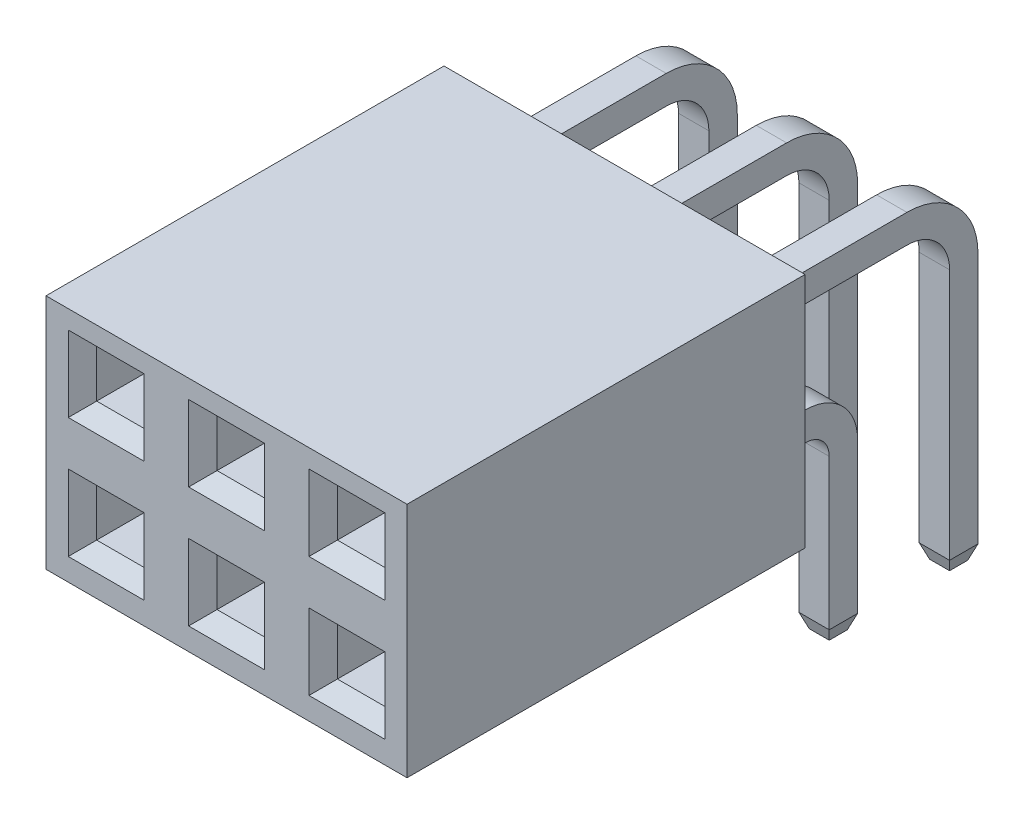
from build123d import *
from OCP.BRepFilletAPI import BRepFilletAPI_MakeChamfer
from build123d.topology import SkipClean

# Parameters (mm, degrees)
EXTRUDE_2563_DEPTH                    = 0.32
EXTRUDE_2563_2_DEPTH                  = 0.32
SKETCH_2_W                            = 2.54
SKETCH_2_H                            = 8.4
EXTRUDE_2921_DEPTH                    = 5
SKETCH_3_W                            = 1
SKETCH_3_H                            = 1
CUT_EXTRUDE_3170_DEPTH                = 6
CHAMFER_1_SIZE                        = 0.3
CHAMFER_2_SIZE                        = 0.3
CHAMFER_2_SIZE2                       = 0.10919107
PATTERN_LINEAR_3747_COUNT             = 3
PATTERN_LINEAR_3747_PITCH             = 2.54
CHAMFER_1_OF_PATTERN_LINEAR_3747_SIZE = 0.3
PATTERN_START                         = -5.29080893
PATTERN_LINEAR_12180_DEPTH            = 0.42161786
PATTERN_START_2                       = -2.75080893
PATTERN_LINEAR_12180_2_DEPTH          = 0.42161786
PATTERN_START_3                       = -0.19080893
PATTERN_LINEAR_12180_3_OUTLINE_W      = 0.10919107
PATTERN_LINEAR_12180_3_OUTLINE_H      = 0.6
PATTERN_LINEAR_12180_3_DEPTH          = 0.99080893
PATTERN_START_4                       = -2.84
PATTERN_LINEAR_12180_4_DEPTH          = 0.6
PATTERN_START_5                       = -2.73080893
PATTERN_LINEAR_12180_5_OUTLINE_W      = 0.10919107
PATTERN_LINEAR_12180_5_OUTLINE_H      = 2.54
PATTERN_LINEAR_12180_5_DEPTH          = 1.39080893
PATTERN_START_6                       = -1.484615596
PATTERN_LINEAR_12180_6_OUTLINE_W      = 0.10919107
PATTERN_LINEAR_12180_6_OUTLINE_H      = 0.6
PATTERN_LINEAR_12180_6_DEPTH          = 4.484615596
PATTERN_START_7                       = 0.719658002
PATTERN_LINEAR_12180_7_OUTLINE_W      = 0.10919107
PATTERN_LINEAR_12180_7_OUTLINE_H      = 0.6
PATTERN_LINEAR_12180_7_DEPTH          = 2.280341998
PATTERN_START_8                       = -0.3
PATTERN_LINEAR_12180_8_DEPTH          = 0.49080893
PATTERN_START_9                       = -5.4
PATTERN_LINEAR_12180_9_DEPTH          = 3.18


with BuildPart() as part:
    # Эскиз1 → Extrude 2563 (new, symmetric)
    with BuildSketch(Plane(origin=(0, 0, 0), x_dir=(0, 0, -1), z_dir=(1, 0, 0))):
        with BuildLine():
            Line((0.3, -3), (0.3, 0.47))
            ThreePointArc((0.3, 0.47), (-0.022182541, 1.247817459), (-0.8, 1.57))
            Line((-0.8, 1.57), (-4.16, 1.57))
            Line((-4.16, 1.57), (-4.16, 0.97))
            Line((-4.16, 0.97), (-0.8, 0.97))
            ThreePointArc((-0.8, 0.97), (-0.446446609, 0.823553391), (-0.3, 0.47))
            Line((-0.3, 0.47), (-0.3, -3))
            Line((-0.3, -3), (0.3, -3))
        make_face()
    extrude(amount=EXTRUDE_2563_DEPTH, both=True)



with BuildPart() as body_2:
    # Эскиз1 → Extrude 2563 2 (new, symmetric)
    with BuildSketch(Plane(origin=(0, 0, 0), x_dir=(0, 0, -1), z_dir=(1, 0, 0))):
        with BuildLine():
            Line((2.84, -3), (2.84, 2.61))
            ThreePointArc((2.84, 2.61), (2.400660172, 3.670660172), (1.34, 4.11))
            Line((1.34, 4.11), (-4.16, 4.11))
            Line((-4.16, 4.11), (-4.16, 3.51))
            Line((-4.16, 3.51), (1.34, 3.51))
            ThreePointArc((1.34, 3.51), (1.976396103, 3.246396103), (2.24, 2.61))
            Line((2.24, 2.61), (2.24, -3))
            Line((2.24, -3), (2.84, -3))
        make_face()
    extrude(amount=EXTRUDE_2563_2_DEPTH, both=True)


with BuildPart() as part_1:
    add(part.part)

    add(body_2.part)  # Extrude 2921 merges body 2
    # Эскиз2 → Extrude 2921 (add)
    with BuildSketch(Plane(origin=(0, 0, 0), x_dir=(1, 0, 0), z_dir=(0, 1, 0))):
        with Locations((0, -5.96)):
            Rectangle(SKETCH_2_W, SKETCH_2_H)
    extrude_2921 = extrude(amount=EXTRUDE_2921_DEPTH)

    # Эскиз3 → Cut-Extrude 3170 (cut)
    with BuildSketch(Plane.XY.offset(10.16)):
        with Locations((0, 1.27)):
            Rectangle(SKETCH_3_W, SKETCH_3_H)
        with Locations((0, 3.81)):
            Rectangle(SKETCH_3_W, SKETCH_3_H)
    cut_extrude_3170 = extrude(amount=-CUT_EXTRUDE_3170_DEPTH, mode=Mode.SUBTRACT)

    # Фаска1
    chamfer_1_edges = [part_1.edges().sort_by_distance(p)[0] for p in [
        (-0.5, 1.27, 10.16),
        (0, 0.77, 10.16),
        (0.5, 1.27, 10.16),
        (0, 1.77, 10.16),
        (-0.5, 3.81, 10.16),
        (0, 3.31, 10.16),
        (0.5, 3.81, 10.16),
        (0, 4.31, 10.16),
    ]]
    chamfer(chamfer_1_edges, length=CHAMFER_1_SIZE)

    # Фаска2: one chamfer whose edges measure the first distance from different faces: ONE call of the kernel's chamfer builder (chamfer() names one face for all edges)
    chamfer_2_edges_1 = [part_1.edges().sort_by_distance(p)[0] for p in [
        (-0.32, -3, 0),
    ]]
    chamfer_2_side_1 = [part_1.faces().sort_by_distance(p)[0] for p in [
        (-0.32, -0.335827759, 0.275050022),
    ]]
    chamfer_2_edges_2 = [part_1.edges().sort_by_distance(p)[0] for p in [
        (0, -3, 0.3),
    ]]
    chamfer_2_side_2 = [part_1.faces().sort_by_distance(p)[0] for p in [
        (0, -1.265, 0.3),
    ]]
    chamfer_2_edges_3 = [part_1.edges().sort_by_distance(p)[0] for p in [
        (0, -3, -0.3),
    ]]
    chamfer_2_side_3 = [part_1.faces().sort_by_distance(p)[0] for p in [
        (0, -1.265, -0.3),
    ]]
    chamfer_2_edges_4 = [part_1.edges().sort_by_distance(p)[0] for p in [
        (0.32, -3, 0),
    ]]
    chamfer_2_side_4 = [part_1.faces().sort_by_distance(p)[0] for p in [
        (0.32, -0.335827759, 0.275050022),
    ]]
    chamfer_2_edges_5 = [part_1.edges().sort_by_distance(p)[0] for p in [
        (0.32, -3, -2.54),
    ]]
    chamfer_2_side_5 = [part_1.faces().sort_by_distance(p)[0] for p in [
        (0.32, -2.915317003, -2.54),
    ]]
    chamfer_2_edges_6 = [part_1.edges().sort_by_distance(p)[0] for p in [
        (-0.32, -3, -2.54),
    ]]
    chamfer_2_side_6 = [part_1.faces().sort_by_distance(p)[0] for p in [
        (-0.32, -2.915317003, -2.54),
    ]]
    chamfer_2_edges_7 = [part_1.edges().sort_by_distance(p)[0] for p in [
        (0, -3, -2.24),
    ]]
    chamfer_2_side_7 = [part_1.faces().sort_by_distance(p)[0] for p in [
        (0, -0.195, -2.24),
    ]]
    chamfer_2_edges_8 = [part_1.edges().sort_by_distance(p)[0] for p in [
        (0, -3, -2.84),
    ]]
    chamfer_2_side_8 = [part_1.faces().sort_by_distance(p)[0] for p in [
        (0, -0.195, -2.84),
    ]]
    chamfer_2 = BRepFilletAPI_MakeChamfer(part_1.part.solid().wrapped)
    for e in chamfer_2_edges_1:
        chamfer_2.Add(CHAMFER_2_SIZE, CHAMFER_2_SIZE2, e.wrapped, chamfer_2_side_1[0].wrapped)  # the first distance lies on this face
    for e in chamfer_2_edges_2:
        chamfer_2.Add(CHAMFER_2_SIZE, CHAMFER_2_SIZE2, e.wrapped, chamfer_2_side_2[0].wrapped)  # the first distance lies on this face
    for e in chamfer_2_edges_3:
        chamfer_2.Add(CHAMFER_2_SIZE, CHAMFER_2_SIZE2, e.wrapped, chamfer_2_side_3[0].wrapped)  # the first distance lies on this face
    for e in chamfer_2_edges_4:
        chamfer_2.Add(CHAMFER_2_SIZE, CHAMFER_2_SIZE2, e.wrapped, chamfer_2_side_4[0].wrapped)  # the first distance lies on this face
    for e in chamfer_2_edges_5:
        chamfer_2.Add(CHAMFER_2_SIZE, CHAMFER_2_SIZE2, e.wrapped, chamfer_2_side_5[0].wrapped)  # the first distance lies on this face
    for e in chamfer_2_edges_6:
        chamfer_2.Add(CHAMFER_2_SIZE, CHAMFER_2_SIZE2, e.wrapped, chamfer_2_side_6[0].wrapped)  # the first distance lies on this face
    for e in chamfer_2_edges_7:
        chamfer_2.Add(CHAMFER_2_SIZE, CHAMFER_2_SIZE2, e.wrapped, chamfer_2_side_7[0].wrapped)  # the first distance lies on this face
    for e in chamfer_2_edges_8:
        chamfer_2.Add(CHAMFER_2_SIZE, CHAMFER_2_SIZE2, e.wrapped, chamfer_2_side_8[0].wrapped)  # the first distance lies on this face
    add(Compound.cast(chamfer_2.Shape()), mode=Mode.REPLACE)

    # Pattern Linear 3747: Extrude 2921, Cut-Extrude 3170 ×3
    with Locations(*[(-i * PATTERN_LINEAR_3747_PITCH, 0, 0) for i in range(1, PATTERN_LINEAR_3747_COUNT)]):
        add(extrude_2921)
        add(cut_extrude_3170, mode=Mode.SUBTRACT)

    # Фаска1 of Pattern Linear 3747
    chamfer_1_of_pattern_linear_3747_edges = [part_1.edges().sort_by_distance(p)[0] for p in [
        (-3.04, 1.27, 10.16),
        (-2.54, 0.77, 10.16),
        (-2.04, 1.27, 10.16),
        (-2.54, 1.77, 10.16),
        (-3.04, 3.81, 10.16),
        (-2.54, 3.31, 10.16),
        (-2.04, 3.81, 10.16),
        (-2.54, 4.31, 10.16),
        (-5.58, 1.27, 10.16),
        (-5.08, 0.77, 10.16),
        (-4.58, 1.27, 10.16),
        (-5.08, 1.77, 10.16),
        (-5.58, 3.81, 10.16),
        (-5.08, 3.31, 10.16),
        (-4.58, 3.81, 10.16),
        (-5.08, 4.31, 10.16),
    ]]
    chamfer(chamfer_1_of_pattern_linear_3747_edges, length=CHAMFER_1_OF_PATTERN_LINEAR_3747_SIZE)

    # Pattern Linear 12180: read off the stored shape, not the designer's step
    # Pattern Linear 12180 outline → Pattern Linear 12180 (add)
    with BuildSketch(Plane.YZ.offset(PATTERN_START)):
        with BuildLine():
            Line((4.11, 1.76), (3.51, 1.76))
            Line((3.51, 1.76), (3.51, -1.34))
            ThreePointArc((3.51, -1.34), (3.246396103, -1.976396103), (2.61, -2.24))
            Line((2.61, -2.24), (-2.7, -2.24))
            Line((-2.7, -2.24), (-3, -2.34919107))
            Line((-3, -2.34919107), (-3, -2.73080893))
            Line((-3, -2.73080893), (-2.7, -2.84))
            Line((-2.7, -2.84), (2.61, -2.84))
            ThreePointArc((2.61, -2.84), (3.670660172, -2.400660172), (4.11, -1.34))
            Line((4.11, -1.34), (4.11, 1.76))
        make_face()
        with BuildLine():
            Line((1.57, 0.8), (1.57, 1.76))
            Line((1.57, 1.76), (0.97, 1.76))
            Line((0.97, 1.76), (0.97, 0.8))
            ThreePointArc((0.97, 0.8), (0.823553391, 0.446446609), (0.47, 0.3))
            Line((0.47, 0.3), (-2.7, 0.3))
            Line((-2.7, 0.3), (-3, 0.19080893))
            Line((-3, 0.19080893), (-3, -0.19080893))
            Line((-3, -0.19080893), (-2.7, -0.3))
            Line((-2.7, -0.3), (0.47, -0.3))
            ThreePointArc((0.47, -0.3), (1.247817459, 0.022182541), (1.57, 0.8))
        make_face()
    extrude(amount=PATTERN_LINEAR_12180_DEPTH)

    # Pattern Linear 12180 2 outline → Pattern Linear 12180 2 (add)
    with BuildSketch(Plane.YZ.offset(PATTERN_START_2)):
        with BuildLine():
            Line((4.11, 1.76), (3.51, 1.76))
            Line((3.51, 1.76), (3.51, -1.34))
            ThreePointArc((3.51, -1.34), (3.246396103, -1.976396103), (2.61, -2.24))
            Line((2.61, -2.24), (-2.7, -2.24))
            Line((-2.7, -2.24), (-3, -2.34919107))
            Line((-3, -2.34919107), (-3, -2.73080893))
            Line((-3, -2.73080893), (-2.7, -2.84))
            Line((-2.7, -2.84), (2.61, -2.84))
            ThreePointArc((2.61, -2.84), (3.670660172, -2.400660172), (4.11, -1.34))
            Line((4.11, -1.34), (4.11, 1.76))
        make_face()
        with BuildLine():
            Line((1.57, 0.8), (1.57, 1.76))
            Line((1.57, 1.76), (0.97, 1.76))
            Line((0.97, 1.76), (0.97, 0.8))
            ThreePointArc((0.97, 0.8), (0.823553391, 0.446446609), (0.47, 0.3))
            Line((0.47, 0.3), (-2.7, 0.3))
            Line((-2.7, 0.3), (-3, 0.19080893))
            Line((-3, 0.19080893), (-3, -0.19080893))
            Line((-3, -0.19080893), (-2.7, -0.3))
            Line((-2.7, -0.3), (0.47, -0.3))
            ThreePointArc((0.47, -0.3), (1.247817459, 0.022182541), (1.57, 0.8))
        make_face()
    extrude(amount=PATTERN_LINEAR_12180_2_DEPTH)

    # Pattern Linear 12180 3 outline → Pattern Linear 12180 3 (add)
    with BuildSketch(Plane.XY.offset(PATTERN_START_3)):
        Polygon((-2.75080893, 1.57), (-2.86, 1.57), (-2.86, -2.7), (-2.75080893, -3), align=None)
        with Locations((-2.805404465, 3.81)):
            Rectangle(PATTERN_LINEAR_12180_3_OUTLINE_W, PATTERN_LINEAR_12180_3_OUTLINE_H)
        Polygon((-2.22, 1.57), (-2.32919107, 1.57), (-2.32919107, -3), (-2.22, -2.7), align=None)
        with Locations((-2.274595535, 3.81)):
            Rectangle(PATTERN_LINEAR_12180_3_OUTLINE_W, PATTERN_LINEAR_12180_3_OUTLINE_H)
        Polygon((-5.29080893, 1.57), (-5.4, 1.57), (-5.4, -2.7), (-5.29080893, -3), align=None)
        with Locations((-5.345404465, 3.81)):
            Rectangle(PATTERN_LINEAR_12180_3_OUTLINE_W, PATTERN_LINEAR_12180_3_OUTLINE_H)
        Polygon((-4.76, 1.57), (-4.86919107, 1.57), (-4.86919107, -3), (-4.76, -2.7), align=None)
        with Locations((-4.814595535, 3.81)):
            Rectangle(PATTERN_LINEAR_12180_3_OUTLINE_W, PATTERN_LINEAR_12180_3_OUTLINE_H)
    extrude(amount=PATTERN_LINEAR_12180_3_DEPTH)

    # Pattern Linear 12180 4 outline → Pattern Linear 12180 4 (add)
    with BuildSketch(Plane.XY.offset(PATTERN_START_4)):
        Polygon((-2.86, 3.51), (-2.86, -2.7), (-2.75080893, -3), (-2.75080893, 3.51), align=None)
        Polygon((-2.32919107, 3.51), (-2.32919107, -3), (-2.22, -2.7), (-2.22, 3.51), align=None)
        Polygon((-5.4, 3.51), (-5.4, -2.7), (-5.29080893, -3), (-5.29080893, 3.51), align=None)
        Polygon((-4.86919107, 3.51), (-4.86919107, -3), (-4.76, -2.7), (-4.76, 3.51), align=None)
    extrude(amount=PATTERN_LINEAR_12180_4_DEPTH)

    # Pattern Linear 12180 5 outline → Pattern Linear 12180 5 (add)
    with BuildSketch(Plane.XY.offset(PATTERN_START_5)):
        with Locations((-2.805404465, 2.84)):
            Rectangle(PATTERN_LINEAR_12180_5_OUTLINE_W, PATTERN_LINEAR_12180_5_OUTLINE_H)
        with Locations((-2.274595535, 2.84)):
            Rectangle(PATTERN_LINEAR_12180_5_OUTLINE_W, PATTERN_LINEAR_12180_5_OUTLINE_H)
        with Locations((-5.345404465, 2.84)):
            Rectangle(PATTERN_LINEAR_12180_5_OUTLINE_W, PATTERN_LINEAR_12180_5_OUTLINE_H)
        with Locations((-4.814595535, 2.84)):
            Rectangle(PATTERN_LINEAR_12180_5_OUTLINE_W, PATTERN_LINEAR_12180_5_OUTLINE_H)
    extrude(amount=PATTERN_LINEAR_12180_5_DEPTH)

    # Pattern Linear 12180 6 outline → Pattern Linear 12180 6 (add)
    with BuildSketch(Plane.XY.offset(PATTERN_START_6)):
        with Locations((-2.805404465, 3.81)):
            Rectangle(PATTERN_LINEAR_12180_6_OUTLINE_W, PATTERN_LINEAR_12180_6_OUTLINE_H)
        with Locations((-2.274595535, 3.81)):
            Rectangle(PATTERN_LINEAR_12180_6_OUTLINE_W, PATTERN_LINEAR_12180_6_OUTLINE_H)
        with Locations((-5.345404465, 3.81)):
            Rectangle(PATTERN_LINEAR_12180_6_OUTLINE_W, PATTERN_LINEAR_12180_6_OUTLINE_H)
        with Locations((-4.814595535, 3.81)):
            Rectangle(PATTERN_LINEAR_12180_6_OUTLINE_W, PATTERN_LINEAR_12180_6_OUTLINE_H)
    extrude(amount=PATTERN_LINEAR_12180_6_DEPTH)

    # Pattern Linear 12180 7 outline → Pattern Linear 12180 7 (add)
    with BuildSketch(Plane.XY.offset(PATTERN_START_7)):
        with Locations((-2.805404465, 1.27)):
            Rectangle(PATTERN_LINEAR_12180_7_OUTLINE_W, PATTERN_LINEAR_12180_7_OUTLINE_H)
        with Locations((-2.274595535, 1.27)):
            Rectangle(PATTERN_LINEAR_12180_7_OUTLINE_W, PATTERN_LINEAR_12180_7_OUTLINE_H)
        with Locations((-5.345404465, 1.27)):
            Rectangle(PATTERN_LINEAR_12180_7_OUTLINE_W, PATTERN_LINEAR_12180_7_OUTLINE_H)
        with Locations((-4.814595535, 1.27)):
            Rectangle(PATTERN_LINEAR_12180_7_OUTLINE_W, PATTERN_LINEAR_12180_7_OUTLINE_H)
    extrude(amount=PATTERN_LINEAR_12180_7_DEPTH)

    # Pattern Linear 12180 8 outline → Pattern Linear 12180 8 (add)
    with BuildSketch(Plane.XY.offset(PATTERN_START_8)):
        Polygon((-2.75080893, 0.97), (-2.86, 0.97), (-2.86, -2.7), (-2.75080893, -3), align=None)
        Polygon((-2.22, 0.97), (-2.32919107, 0.97), (-2.32919107, -3), (-2.22, -2.7), align=None)
        Polygon((-5.29080893, 0.97), (-5.4, 0.97), (-5.4, -2.7), (-5.29080893, -3), align=None)
        Polygon((-4.76, 0.97), (-4.86919107, 0.97), (-4.86919107, -3), (-4.76, -2.7), align=None)
    extrude(amount=PATTERN_LINEAR_12180_8_DEPTH)

    # Pattern Linear 12180 9 outline → Pattern Linear 12180 9 (cut)
    with SkipClean():  # the faces are left unmerged after this step: merging them gives an invalid solid
        with BuildSketch(Plane.YZ.offset(PATTERN_START_9)):
            with BuildLine():
                ThreePointArc((4.11, -1.34), (3.670660172, -2.400660172), (2.61, -2.84))
                Line((2.61, -2.84), (3.51, -2.84))
                Line((3.51, -2.84), (3.51, -2.73080893))
                Line((3.51, -2.73080893), (4.11, -2.73080893))
                Line((4.11, -2.73080893), (4.11, -1.34))
            make_face()
            Polygon((-3, -2.84), (-2.7, -2.84), (-3, -2.73080893), align=None)
            Polygon((-3, -2.34919107), (-2.7, -2.24), (-3, -2.24), align=None)
            with BuildLine():
                Line((1.57, -1.34), (1.57, -2.24))
                Line((1.57, -2.24), (2.61, -2.24))
                ThreePointArc((2.61, -2.24), (3.246396103, -1.976396103), (3.51, -1.34))
                Line((3.51, -1.34), (1.57, -1.34))
            make_face()
            Polygon((-3, -0.19080893), (-3, -0.3), (-2.7, -0.3), align=None)
            with BuildLine():
                ThreePointArc((1.57, 0.8), (1.247817459, 0.022182541), (0.47, -0.3))
                Line((0.47, -0.3), (0.97, -0.3))
                Line((0.97, -0.3), (0.97, -0.19080893))
                Line((0.97, -0.19080893), (1.57, -0.19080893))
                Line((1.57, -0.19080893), (1.57, 0.8))
            make_face()
            with BuildLine():
                Line((0.97, 0.8), (-3, 0.8))
                Line((-3, 0.8), (-3, 0.19080893))
                Line((-3, 0.19080893), (-2.7, 0.3))
                Line((-2.7, 0.3), (0.47, 0.3))
                ThreePointArc((0.47, 0.3), (0.823553391, 0.446446609), (0.97, 0.8))
            make_face()
        extrude(amount=PATTERN_LINEAR_12180_9_DEPTH, mode=Mode.SUBTRACT)


solid = part_1.part
